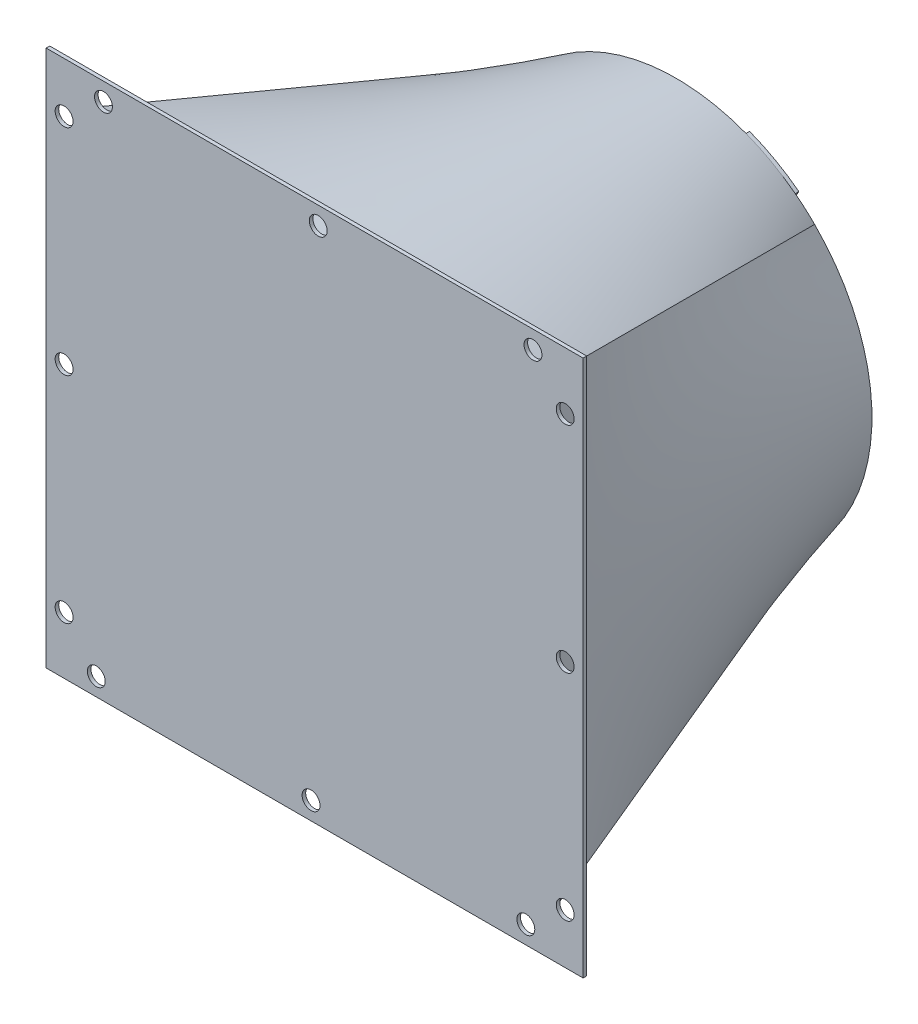
from build123d import *

# Parameters (mm, degrees)
ESTRUSIONE_ESTRUSIONE1_DEPTH   = 5
ESTRUSIONE_ESTRUSIONE1_2_DEPTH = 5
ESTRUSIONE_ESTRUSIONE1_3_DEPTH = 5
SCHIZZO4_W                     = 750
SCHIZZO4_H                     = 750
ESTRUSIONE_ESTRUSIONE2_DEPTH   = 5
SCHIZZO5_R                     = 9.25
TAGLIO_ESTRUSIONE1_DEPTH       = 100
SCHIZZO6_R                     = 12.5
TAGLIO_ESTRUSIONE2_DEPTH       = 100


with BuildPart() as part:
    # Schizzo1 → Estrusione-Estrusione1 (new body)
    with BuildSketch(Plane.XY):
        with BuildLine():
            Line((166.379556972, -217.112681656), (131.957957006, -157.492721637))
            ThreePointArc((131.957957006, -157.492721637), (95.847641183, -181.741820904), (55.441856214, -197.846052185))
            ThreePointArc((55.441856214, -197.846052185), (75.485100772, -227.443381025), (97.597624139, -255.528427531))
            ThreePointArc((97.597624139, -255.528427531), (133.378897955, -238.809847147), (166.379556972, -217.112681656))
        make_face()
        with BuildLine():
            ThreePointArc((125, -225.756350946), (134.25, -216.506350946), (125, -207.256350946))
            ThreePointArc((125, -207.256350946), (115.75, -216.506350946), (125, -225.756350946))
        make_face(mode=Mode.SUBTRACT)
    extrude(amount=ESTRUSIONE_ESTRUSIONE1_DEPTH)



with BuildPart() as body_2:
    # Schizzo1 → Estrusione-Estrusione1 2 (new body)
    with BuildSketch(Plane.XY):
        with BuildLine():
            Line((131.957957006, 157.492721637), (166.379556972, 217.112681656))
            ThreePointArc((166.379556972, 217.112681656), (133.378897955, 238.809847147), (97.597624139, 255.528427531))
            ThreePointArc((97.597624139, 255.528427531), (75.485100772, 227.443381025), (55.441856214, 197.846052185))
            ThreePointArc((55.441856214, 197.846052185), (95.847641183, 181.741820904), (131.957957006, 157.492721637))
        make_face()
        with BuildLine():
            ThreePointArc((125, 225.756350946), (115.75, 216.506350946), (125, 207.256350946))
            ThreePointArc((125, 207.256350946), (134.25, 216.506350946), (125, 225.756350946))
        make_face(mode=Mode.SUBTRACT)
    extrude(amount=ESTRUSIONE_ESTRUSIONE1_2_DEPTH)


with BuildPart() as body_3:
    # Schizzo1 → Estrusione-Estrusione1 3 (new body)
    with BuildSketch(Plane.XY):
        with BuildLine():
            Line((-273.244831019, 12.543358215), (-267.235835007, 12.543358215))
            Line((-267.235835007, 12.543358215), (-267.235835007, -12.543358215))
            Line((-267.235835007, -12.543358215), (-273.244831019, -12.543358215))
            ThreePointArc((-273.244831019, -12.543358215), (-272.472419382, -24.059388817), (-271.214876284, -35.53258218))
            Line((-271.214876284, -35.53258218), (-202.371676351, -35.53258218))
            ThreePointArc((-202.371676351, -35.53258218), (-205.46741782, 0), (-202.371676351, 35.53258218))
            Line((-202.371676351, 35.53258218), (-271.214876284, 35.53258218))
            ThreePointArc((-271.214876284, 35.53258218), (-272.472419382, 24.059388817), (-273.244831019, 12.543358215))
        make_face()
        with BuildLine():
            ThreePointArc((-250, -9.25), (-240.75, 0), (-250, 9.25))
            ThreePointArc((-250, 9.25), (-259.25, 0), (-250, -9.25))
        make_face(mode=Mode.SUBTRACT)
    extrude(amount=ESTRUSIONE_ESTRUSIONE1_3_DEPTH)


with BuildPart() as part_1:
    add(part.part)

    add(body_2.part)  # Loft1 merges body 2

    add(body_3.part)  # Loft1 merges body 3
    # Schizzo3 → Loft1 section 0
    with BuildSketch(Plane.XY.offset(505)):
        with BuildLine():
            Line((325, -325), (-325, -325))
            Line((-325, -325), (-325, 325))
            Line((-325, 325), (325, 325))
            Line((325, 325), (325, -325))
        make_face()
    # Schizzo2 for Loft1 → Loft1 section 1
    with BuildSketch(Plane.XY.offset(5)):
        with BuildLine():
            # circular arc as an exact rational Bezier (weights 1, cos(half-angle), 1)
            Bezier((193.416743735, -193.416743735), (0, -386.83348747), (-193.416743735, -193.416743735), weights=[1, 0.707106781, 1])
            Bezier((-193.416743735, -193.416743735), (-386.83348747, 0), (-193.416743735, 193.416743735), weights=[1, 0.707106781, 1])
            Bezier((-193.416743735, 193.416743735), (0, 386.83348747), (193.416743735, 193.416743735), weights=[1, 0.707106781, 1])
            Bezier((193.416743735, 193.416743735), (386.83348747, 0), (193.416743735, -193.416743735), weights=[1, 0.707106781, 1])
        make_face()
    loft()

    # Schizzo4 → Estrusione-Estrusione2 (add)
    with BuildSketch(Plane.XY.offset(505)):
        Rectangle(SCHIZZO4_W, SCHIZZO4_H)
    extrude(amount=ESTRUSIONE_ESTRUSIONE2_DEPTH)

    # Schizzo5 → Taglio-Estrusione1 (cut)
    with BuildSketch(Plane(origin=(0, 0, 5), x_dir=(-1, 0, 0), z_dir=(0, 0, -1))):
        with Locations((-125, -216.506350946)):
            Circle(SCHIZZO5_R)
        with Locations((250, 0)):
            Circle(SCHIZZO5_R)
        with Locations((-125, 216.506350946)):
            Circle(SCHIZZO5_R)
    extrude(amount=-TAGLIO_ESTRUSIONE1_DEPTH, mode=Mode.SUBTRACT)

    # Schizzo6 → Taglio-Estrusione2 (cut)
    with BuildSketch(Plane(origin=(0, 0, 505), x_dir=(-1, 0, 0), z_dir=(0, 0, -1))):
        with Locations((-305, 350)):
            Circle(SCHIZZO6_R)
        with Locations((-5, 350)):
            Circle(SCHIZZO6_R)
        with Locations((295, 350)):
            Circle(SCHIZZO6_R)
        with Locations((350, 305)):
            Circle(SCHIZZO6_R)
        with Locations((350, 5)):
            Circle(SCHIZZO6_R)
        with Locations((350, -295)):
            Circle(SCHIZZO6_R)
        with Locations((305, -350)):
            Circle(SCHIZZO6_R)
        with Locations((5, -350)):
            Circle(SCHIZZO6_R)
        with Locations((-295, -350)):
            Circle(SCHIZZO6_R)
        with Locations((-350, -305)):
            Circle(SCHIZZO6_R)
        with Locations((-350, -5)):
            Circle(SCHIZZO6_R)
        with Locations((-350, 295)):
            Circle(SCHIZZO6_R)
    extrude(amount=-TAGLIO_ESTRUSIONE2_DEPTH, mode=Mode.SUBTRACT)


solid = part_1.part
